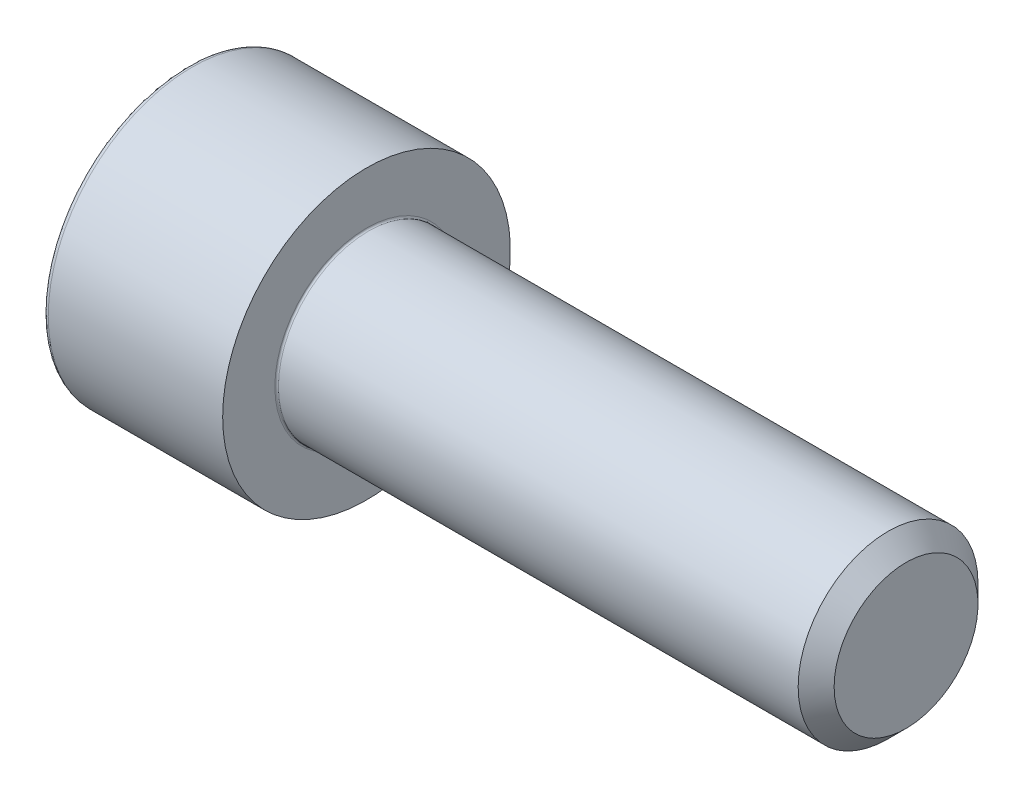
from build123d import *

# Parameters (mm, degrees)
FILLET1_R   = 0.1
FILLET2_R   = 0.3
HEX_2_DEPTH = 1.3


with BuildPart() as part:
    # BodySke → Base-Revolve (revolve)
    with BuildSketch(Plane.XY):
        Polygon((0, 0), (0, 8), (10, 8), (10, 5), (39, 5), (40, 4), (40, 0), align=None)
    revolve(axis=Axis((-31.75, 0, 0), (1, 0, 0)))

    # Fillet1
    fillet1_edges = [part.edges().sort_by_distance(p)[0] for p in [
        (10, -5, 0),
    ]]
    fillet(fillet1_edges, radius=FILLET1_R)

    # Fillet2
    fillet2_edges = [part.edges().sort_by_distance(p)[0] for p in [
        (0, -8, 0),
    ]]
    fillet(fillet2_edges, radius=FILLET2_R)

    # Sketch2 → Hex-PreBroach (revolve, cut)
    with BuildSketch(Plane.XY):
        Polygon((0, 4), (1.3, 4), (3.609401077, 0), (0, 0), align=None)
    revolve(axis=Axis((0, 0, 0), (1, 0, 0)), mode=Mode.SUBTRACT)

    # Sketch3 → Hex 2 (cut)
    with BuildSketch(Plane(origin=(0, 0, 0), x_dir=(0, 0.500000000000001, 0.866025403784438), z_dir=(-1, 0, 0))):
        Polygon((2.309401077, 4), (-2.309401077, 4), (-4.618802154, 0), (-2.309401077, -4), (2.309401077, -4), (4.618802154, 0), align=None)
    extrude(amount=-HEX_2_DEPTH, mode=Mode.SUBTRACT)


solid = part.part
